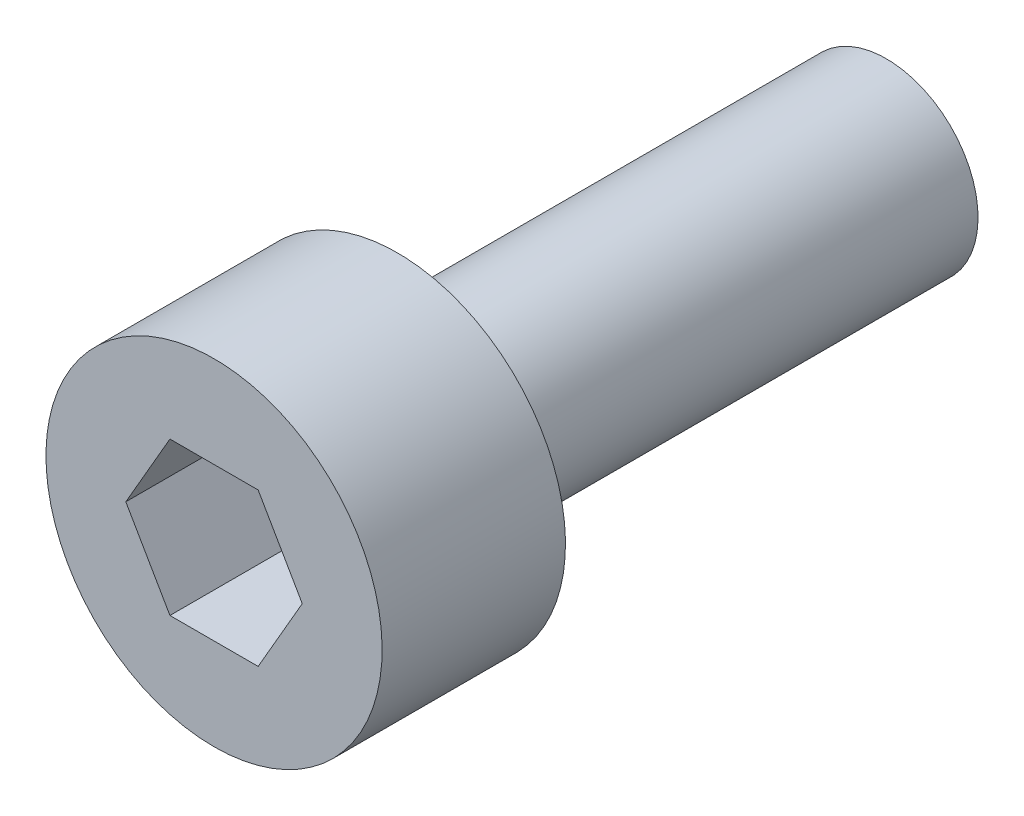
from build123d import *

# Parameters (mm, degrees)
CUT_EXTRUDE1_DEPTH = 2


with BuildPart() as part:
    # Sketch1 → Revolve1 (revolve)
    with BuildSketch(Plane(origin=(0, 0, 0), x_dir=(0, 0, -1), z_dir=(1, 0, 0))):
        Polygon((-3, 0), (-3, 2.75), (0, 2.75), (0, 1.5), (8, 1.5), (8, 0), align=None)
    revolve(axis=Axis((0, 0, 5.584882278), (0, 0, -1)))

    # Sketch2 → Cut-Extrude1 (cut)
    with BuildSketch(Plane.XY.offset(3)):
        Polygon((0.721687836, -1.25), (1.443375673, 0), (0.721687836, 1.25), (-0.721687836, 1.25), (-1.443375673, 0), (-0.721687836, -1.25), align=None)
    extrude(amount=-CUT_EXTRUDE1_DEPTH, mode=Mode.SUBTRACT)


solid = part.part
